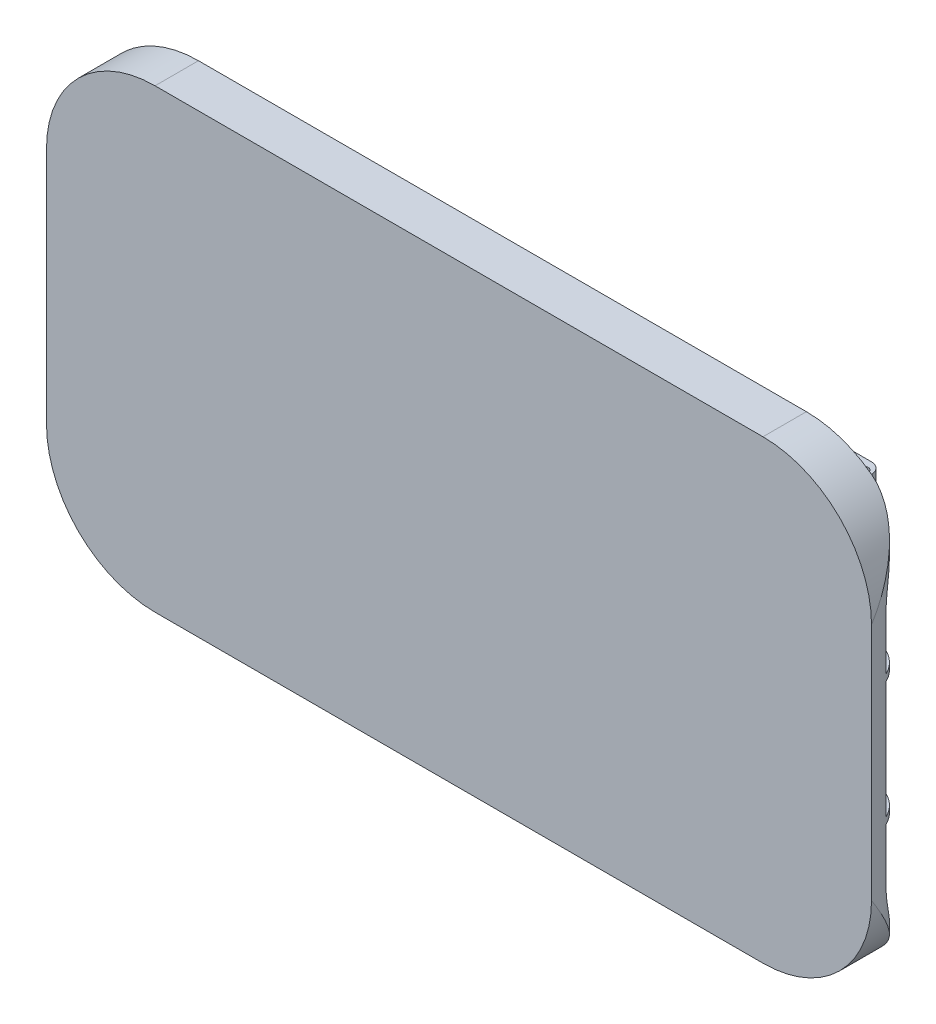
from build123d import *

# Parameters (mm, degrees)
SKETCH1_W                        = 380
SKETCH1_H                        = 160
BOSS_EXTRUDE1_DEPTH              = 3
SKETCH3_W                        = 25
SKETCH3_H                        = 40
SKETCH3_R                        = 2
BOSS_EXTRUDE2_DEPTH              = 5
BOSS_EXTRUDE3_START              = -5
SKETCH4_W                        = 25
SKETCH4_H                        = 40
SKETCH4_R                        = 2
BOSS_EXTRUDE3_DEPTH              = 5
FILLET1_R                        = 5
SKETCH5_W                        = 4
SKETCH5_H                        = 150
BOSS_EXTRUDE4_DEPTH              = 15
CHAMFER1_SIZE                    = 7
SKETCH6_W                        = 380
SKETCH6_H                        = 3
BOSS_EXTRUDE5_DEPTH              = 15
SKETCH7_W                        = 380
SKETCH7_H                        = 210
BOSS_EXTRUDE6_DEPTH              = 3
FILLET3_R                        = 50
BOSS_EXTRUDE7_START              = -20
BOSS_EXTRUDE7_DEPTH              = 20
CUT_EXTRUDE1_DEPTH               = 286.602871
BOSS_EXTRUDE10_REACH             = 237.996
BOSS_EXTRUDE10_DIRECTION_2_REACH = 237.996


with BuildPart() as part:
    # Sketch1 → Boss-Extrude1 (new body)
    with BuildSketch(Plane.XY):
        with Locations((0, 10)):
            Rectangle(SKETCH1_W, SKETCH1_H)
    extrude(amount=BOSS_EXTRUDE1_DEPTH)

    # Sketch3 → Boss-Extrude2 (add)
    # profile 1 of 4: a face of its own
    with BuildSketch(Plane.XZ.offset(70)):
        with Locations((-142.5, -17)):
            Rectangle(SKETCH3_W, SKETCH3_H)
        with Locations((-151.5, -32)):
            Circle(SKETCH3_R, mode=Mode.SUBTRACT)
        with Locations((-133.5, -32)):
            Circle(SKETCH3_R, mode=Mode.SUBTRACT)
    # profile 2 of 4: a face of its own
    with BuildSketch(Plane.XZ.offset(70)):
        with Locations((-47.5, -17)):
            Rectangle(SKETCH3_W, SKETCH3_H)
        with Locations((-56.5, -32)):
            Circle(SKETCH3_R, mode=Mode.SUBTRACT)
        with Locations((-38.5, -32)):
            Circle(SKETCH3_R, mode=Mode.SUBTRACT)
    # profile 3 of 4: a face of its own
    with BuildSketch(Plane.XZ.offset(70)):
        with Locations((47.5, -17)):
            Rectangle(SKETCH3_W, SKETCH3_H)
        with Locations((38.5, -32)):
            Circle(SKETCH3_R, mode=Mode.SUBTRACT)
        with Locations((56.5, -32)):
            Circle(SKETCH3_R, mode=Mode.SUBTRACT)
    # profile 4 of 4: a face of its own
    with BuildSketch(Plane.XZ.offset(70)):
        with Locations((142.5, -17)):
            Rectangle(SKETCH3_W, SKETCH3_H)
        with Locations((133.5, -32)):
            Circle(SKETCH3_R, mode=Mode.SUBTRACT)
        with Locations((151.5, -32)):
            Circle(SKETCH3_R, mode=Mode.SUBTRACT)
    extrude(amount=-BOSS_EXTRUDE2_DEPTH)

    # Sketch4 → Boss-Extrude3 (add)
    # profile 1 of 4: a face of its own
    with BuildSketch(Plane(origin=(0, 90, 0), x_dir=(1, 0, 0), z_dir=(0, 1, 0)).offset(BOSS_EXTRUDE3_START)):
        with Locations((-142.5, 17)):
            Rectangle(SKETCH4_W, SKETCH4_H)
        with Locations((-133.5, 32)):
            Circle(SKETCH4_R, mode=Mode.SUBTRACT)
        with Locations((-151.5, 32)):
            Circle(SKETCH4_R, mode=Mode.SUBTRACT)
    # profile 2 of 4: a face of its own
    with BuildSketch(Plane(origin=(0, 90, 0), x_dir=(1, 0, 0), z_dir=(0, 1, 0)).offset(BOSS_EXTRUDE3_START)):
        with Locations((-47.5, 17)):
            Rectangle(SKETCH4_W, SKETCH4_H)
        with Locations((-38.5, 32)):
            Circle(SKETCH4_R, mode=Mode.SUBTRACT)
        with Locations((-56.5, 32)):
            Circle(SKETCH4_R, mode=Mode.SUBTRACT)
    # profile 3 of 4: a face of its own
    with BuildSketch(Plane(origin=(0, 90, 0), x_dir=(1, 0, 0), z_dir=(0, 1, 0)).offset(BOSS_EXTRUDE3_START)):
        with Locations((142.5, 17)):
            Rectangle(SKETCH4_W, SKETCH4_H)
        with Locations((151.5, 32)):
            Circle(SKETCH4_R, mode=Mode.SUBTRACT)
        with Locations((133.5, 32)):
            Circle(SKETCH4_R, mode=Mode.SUBTRACT)
    # profile 4 of 4: a face of its own
    with BuildSketch(Plane(origin=(0, 90, 0), x_dir=(1, 0, 0), z_dir=(0, 1, 0)).offset(BOSS_EXTRUDE3_START)):
        with Locations((47.5, 17)):
            Rectangle(SKETCH4_W, SKETCH4_H)
        with Locations((56.5, 32)):
            Circle(SKETCH4_R, mode=Mode.SUBTRACT)
        with Locations((38.5, 32)):
            Circle(SKETCH4_R, mode=Mode.SUBTRACT)
    extrude(amount=BOSS_EXTRUDE3_DEPTH)

    # Fillet1
    fillet1_edges = [part.edges().sort_by_distance(p)[0] for p in [
        (155, 87.5, 0),
        (130, 87.5, 0),
        (60, 87.5, 0),
        (35, 87.5, 0),
        (-60, 87.5, 0),
        (-35, 87.5, 0),
        (-130, 87.5, 0),
        (-155, 87.5, 0),
        (-155, -67.5, 0),
        (-130, -67.5, 0),
        (-35, -67.5, 0),
        (-60, -67.5, 0),
        (35, -67.5, 0),
        (60, -67.5, 0),
        (130, -67.5, 0),
        (155, -67.5, 0),
        (155, -67.5, -37),
        (130, -67.5, -37),
        (60, -67.5, -37),
        (35, -67.5, -37),
        (-35, -67.5, -37),
        (-60, -67.5, -37),
        (-130, -67.5, -37),
        (-155, -67.5, -37),
        (-155, 87.5, -37),
        (-130, 87.5, -37),
        (-35, 87.5, -37),
        (-60, 87.5, -37),
        (60, 87.5, -37),
        (35, 87.5, -37),
        (130, 87.5, -37),
        (155, 87.5, -37),
    ]]
    fillet(fillet1_edges, radius=FILLET1_R)

    # Sketch5 → Boss-Extrude4 (add)
    with BuildSketch(Plane(origin=(0, 0, 0), x_dir=(-1, 0, 0), z_dir=(0, 0, -1))):
        with Locations((142.5, 10)):
            Rectangle(SKETCH5_W, SKETCH5_H)
        with Locations((47.5, 10)):
            Rectangle(SKETCH5_W, SKETCH5_H)
        with Locations((-47.5, 10)):
            Rectangle(SKETCH5_W, SKETCH5_H)
        with Locations((-142.5, 10)):
            Rectangle(SKETCH5_W, SKETCH5_H)
    extrude(amount=BOSS_EXTRUDE4_DEPTH)

    # Chamfer1
    chamfer1_edges = [part.edges().sort_by_distance(p)[0] for p in [
        (142.5, -65, -15),
        (47.5, -65, -15),
        (-47.5, -65, -15),
        (-142.5, -65, -15),
        (-142.5, 85, -15),
        (-47.5, 85, -15),
        (47.5, 85, -15),
        (142.5, 85, -15),
    ]]
    chamfer(chamfer1_edges, length=CHAMFER1_SIZE)

    # Sketch6 → Boss-Extrude5 (add)
    with BuildSketch(Plane(origin=(0, 0, 0), x_dir=(-1, 0, 0), z_dir=(0, 0, -1))):
        with Locations((0, -18.5)):
            Rectangle(SKETCH6_W, SKETCH6_H)
        with Locations((0, 38.5)):
            Rectangle(SKETCH6_W, SKETCH6_H)
    extrude(amount=BOSS_EXTRUDE5_DEPTH)

    # Sketch7 → Boss-Extrude6 (add)
    with BuildSketch(Plane.XY.offset(3)):
        with Locations((0, 10)):
            Rectangle(SKETCH7_W, SKETCH7_H)
    extrude(amount=-BOSS_EXTRUDE6_DEPTH)

    # Fillet3
    fillet3_edges = [part.edges().sort_by_distance(p)[0] for p in [
        (190, -95, 1.5),
        (190, 115, 1.5),
        (-190, 115, 1.5),
        (-190, -95, 1.5),
    ]]
    fillet(fillet3_edges, radius=FILLET3_R)

    # Sketch8 → Boss-Extrude7 (add)
    with BuildSketch(Plane.XY.offset(3).offset(BOSS_EXTRUDE7_START)):
        with BuildLine():
            Line((-140, -95), (140, -95))
            ThreePointArc((140, -95), (175.355339, -80.355339), (190, -45))
            Line((190, -45), (190, 65))
            ThreePointArc((190, 65), (175.355339, 100.355339), (140, 115))
            Line((140, 115), (-140, 115))
            ThreePointArc((-140, 115), (-175.355339, 100.355339), (-190, 65))
            Line((-190, 65), (-190, -45))
            ThreePointArc((-190, -45), (-175.355339, -80.355339), (-140, -95))
        make_face()
        with BuildLine():
            Line((-140, -93), (140, -93))
            ThreePointArc((140, -93), (173.941125, -78.941125), (188, -45))
            Line((188, -45), (188, 65))
            ThreePointArc((188, 65), (173.941125, 98.941125), (140, 113))
            Line((140, 113), (-140, 113))
            ThreePointArc((-140, 113), (-173.941125, 98.941125), (-188, 65))
            Line((-188, 65), (-188, -45))
            ThreePointArc((-188, -45), (-173.941125, -78.941125), (-140, -93))
        make_face(mode=Mode.SUBTRACT)
    extrude(amount=BOSS_EXTRUDE7_DEPTH)

    # Sketch9 → Cut-Extrude1 (cut, through all)
    with BuildSketch(Plane(origin=(0, -95, 0), x_dir=(-1, 0, 0), z_dir=(0, -1, 0))):
        with BuildLine():
            Line((190, -3), (190, 17))
            Line((190, 17), (170, 17))
            ThreePointArc((170, 17), (184.142136, 11.142136), (190, -3))
        make_face()
        with BuildLine():
            Line((-190, 17), (-170, 17))
            ThreePointArc((-170, 17), (-184.142136, 11.142136), (-190, -3))
            Line((-190, -3), (-190, 17))
        make_face()
    extrude(amount=-CUT_EXTRUDE1_DEPTH, mode=Mode.SUBTRACT)

    # Sketch10 → Boss-Extrude10 (add, up to next)
    with BuildSketch(Plane.XZ.offset(20), mode=Mode.PRIVATE) as boss_extrude10_sk1:
        with BuildLine():
            Line((-170, -17), (-170, -15))
            ThreePointArc((-170, -15), (-179.559594, -12.251694), (-186.2, -4.846018))
            Line((-186.2, -4.846018), (-186.2, 0))
            Line((-186.2, 0), (-188, 0))
            Line((-188, 0), (-188, -5.717798))
            ThreePointArc((-188, -5.717798), (-180.621771, -13.946326), (-170, -17))
        make_face()
    boss_extrude10_tool1 = extrude(boss_extrude10_sk1.sketch, amount=BOSS_EXTRUDE10_REACH, mode=Mode.PRIVATE) - part.part
    add(boss_extrude10_tool1.solids().sort_by_distance((-180.49028, -20, -13.736541))[0])

    # Sketch10 → Boss-Extrude10 direction 2 (add, up to next)
    with BuildSketch(Plane.XZ.offset(20), mode=Mode.PRIVATE) as boss_extrude10_direction_2_sk1:
        with BuildLine():
            Line((-170, -17), (-170, -15))
            ThreePointArc((-170, -15), (-179.559594, -12.251694), (-186.2, -4.846018))
            Line((-186.2, -4.846018), (-186.2, 0))
            Line((-186.2, 0), (-188, 0))
            Line((-188, 0), (-188, -5.717798))
            ThreePointArc((-188, -5.717798), (-180.621771, -13.946326), (-170, -17))
        make_face()
    boss_extrude10_direction_2_tool1 = extrude(boss_extrude10_direction_2_sk1.sketch, amount=-BOSS_EXTRUDE10_DIRECTION_2_REACH, mode=Mode.PRIVATE) - part.part
    add(boss_extrude10_direction_2_tool1.solids().sort_by_distance((-180.49028, -20, -13.736541))[0])


solid = part.part
